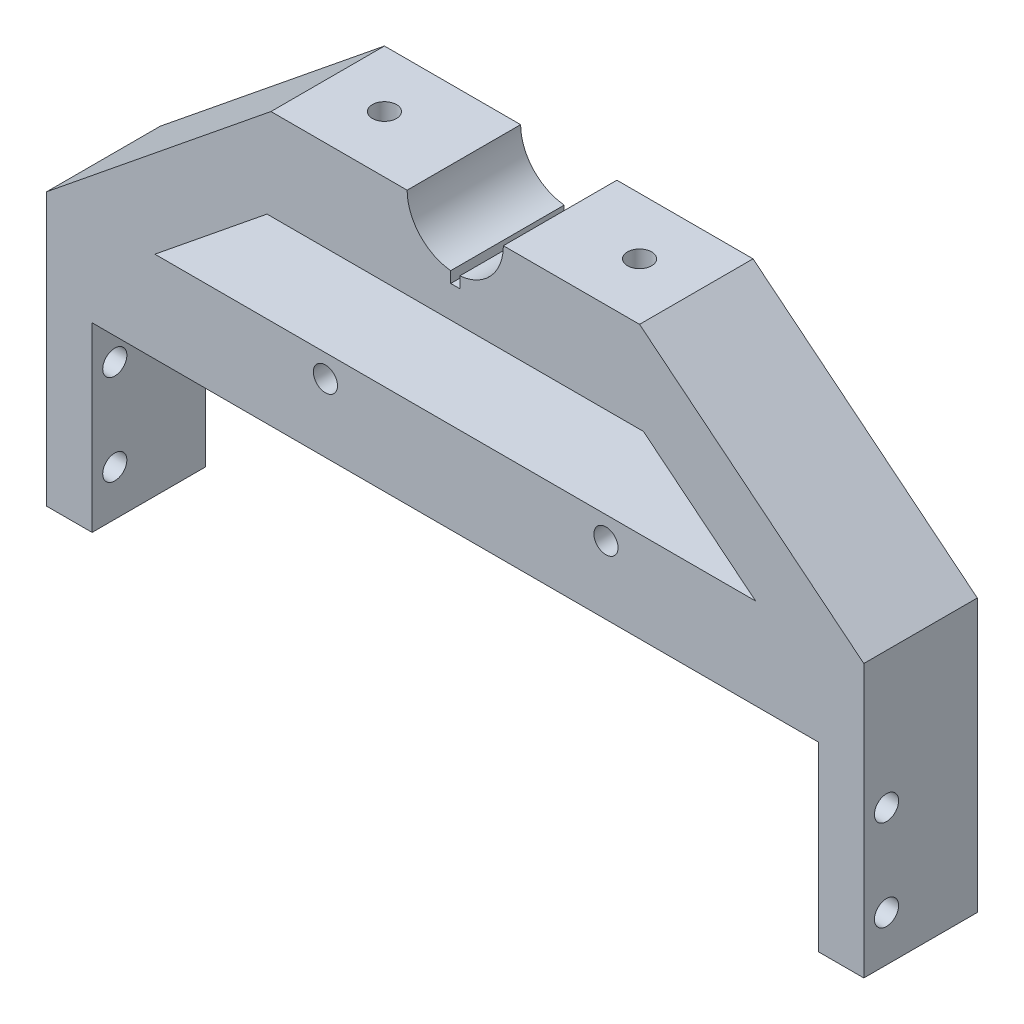
from build123d import *

# Parameters (mm, degrees)
BOSS_EXTRUDE1_DEPTH = 50.8
SKETCH3_R           = 3.3782
CUT_EXTRUDE1_DEPTH  = 25.4
CUT_EXTRUDE2_START  = -25.4
SKETCH4_R           = 3.3782
CUT_EXTRUDE2_DEPTH  = 25.4
SKETCH7_W           = 279.740966103
SKETCH7_H           = 194.949015238
CUT_EXTRUDE5_DEPTH  = 19.05
SKETCH8_W           = 228.6
SKETCH8_H           = 25.4
CUT_EXTRUDE6_DEPTH  = 39.37
SKETCH9_R           = 3.3782
CUT_EXTRUDE7_DEPTH  = 27.94
CUT_EXTRUDE8_DEPTH  = 40.64
SKETCH12_W          = 2.54
SKETCH12_H          = 31.75
CUT_EXTRUDE9_DEPTH  = 16.51
CUT_EXTRUDE10_REACH = 310.809
SKETCH13_R          = 3.3782


with BuildPart() as part:
    # Sketch2 → Boss-Extrude1 (new body)
    with BuildSketch(Plane.XY):
        with BuildLine():
            Line((254, 0), (266.7, 0))
            Line((266.7, 0), (266.7, 101.6))
            Line((266.7, 101.6), (203.962, 152.4))
            Line((203.962, 152.4), (165.862, 152.4))
            ThreePointArc((165.862, 152.4), (152.4, 138.938), (138.938, 152.4))
            Line((138.938, 152.4), (100.838, 152.4))
            Line((100.838, 152.4), (38.1, 101.6))
            Line((38.1, 101.6), (38.1, 0))
            Line((38.1, 0), (50.8, 0))
            Line((50.8, 0), (50.8, 76.2))
            Line((50.8, 76.2), (254, 76.2))
            Line((254, 76.2), (254, 0))
        make_face()
    extrude(amount=BOSS_EXTRUDE1_DEPTH)

    # Sketch3 → Cut-Extrude1 (cut)
    with BuildSketch(Plane.ZY.offset(-38.1)):
        with Locations((25.4, 63.5)):
            Circle(SKETCH3_R)
        with Locations((25.4, 38.1)):
            Circle(SKETCH3_R)
    extrude(amount=-CUT_EXTRUDE1_DEPTH, mode=Mode.SUBTRACT)

    # Sketch4 → Cut-Extrude2 (cut)
    with BuildSketch(Plane(origin=(266.7, 0, 0), x_dir=(0, 0, -1), z_dir=(1, 0, 0)).offset(CUT_EXTRUDE2_START)):
        with Locations((-25.4, 63.5)):
            Circle(SKETCH4_R)
        with Locations((-25.4, 38.1)):
            Circle(SKETCH4_R)
    extrude(amount=CUT_EXTRUDE2_DEPTH, mode=Mode.SUBTRACT)

    # Sketch7 → Cut-Extrude5 (cut)
    with BuildSketch(Plane.XY.offset(50.8)):
        with Locations((152.037641236, 76.2)):
            Rectangle(SKETCH7_W, SKETCH7_H)
    extrude(amount=-CUT_EXTRUDE5_DEPTH, mode=Mode.SUBTRACT)

    # Sketch8 → Cut-Extrude6 (cut)
    with BuildSketch(Plane.XY.offset(31.75)):
        with Locations((152.4, 12.7)):
            Rectangle(SKETCH8_W, SKETCH8_H)
    extrude(amount=-CUT_EXTRUDE6_DEPTH, mode=Mode.SUBTRACT)

    # Sketch9 → Cut-Extrude7 (cut)
    with BuildSketch(Plane(origin=(0, 152.4, 0), x_dir=(1, 0, 0), z_dir=(0, 1, 0))):
        with Locations((116.713, -15.875)):
            Circle(SKETCH9_R)
        with Locations((188.087, -15.875)):
            Circle(SKETCH9_R)
    extrude(amount=-CUT_EXTRUDE7_DEPTH, mode=Mode.SUBTRACT)

    # Sketch10 → Cut-Extrude8 (cut)
    with BuildSketch(Plane.XY.offset(31.75)):
        Polygon((68.372272223, 101.6), (99.741272223, 127), (205.058727777, 127), (236.427727777, 101.6), align=None)
    extrude(amount=-CUT_EXTRUDE8_DEPTH, mode=Mode.SUBTRACT)

    # Sketch12 → Cut-Extrude9 (cut)
    with BuildSketch(Plane(origin=(0, 152.4, 0), x_dir=(1, 0, 0), z_dir=(0, 1, 0))):
        with Locations((152.4, -15.875)):
            Rectangle(SKETCH12_W, SKETCH12_H)
    extrude(amount=-CUT_EXTRUDE9_DEPTH, mode=Mode.SUBTRACT)

    # Sketch13 → Cut-Extrude10 (cut, up to next)
    with BuildSketch(Plane.XY.offset(31.75), mode=Mode.PRIVATE) as cut_extrude10_sk1:
        with Locations((116.078, 95.25)):
            Circle(SKETCH13_R)
    cut_extrude10_tool1 = extrude(cut_extrude10_sk1.sketch, amount=-CUT_EXTRUDE10_REACH, mode=Mode.PRIVATE) & part.part
    # Sketch13 → Cut-Extrude10 (cut, up to next)
    with BuildSketch(Plane.XY.offset(31.75), mode=Mode.PRIVATE) as cut_extrude10_sk2:
        with Locations((194.564, 95.25)):
            Circle(SKETCH13_R)
    cut_extrude10_tool2 = extrude(cut_extrude10_sk2.sketch, amount=-CUT_EXTRUDE10_REACH, mode=Mode.PRIVATE) & part.part
    add(cut_extrude10_tool1.solids().sort_by_distance((116.078, 95.25, 31.75))[0], mode=Mode.SUBTRACT)
    add(cut_extrude10_tool2.solids().sort_by_distance((194.564, 95.25, 31.75))[0], mode=Mode.SUBTRACT)


solid = part.part
